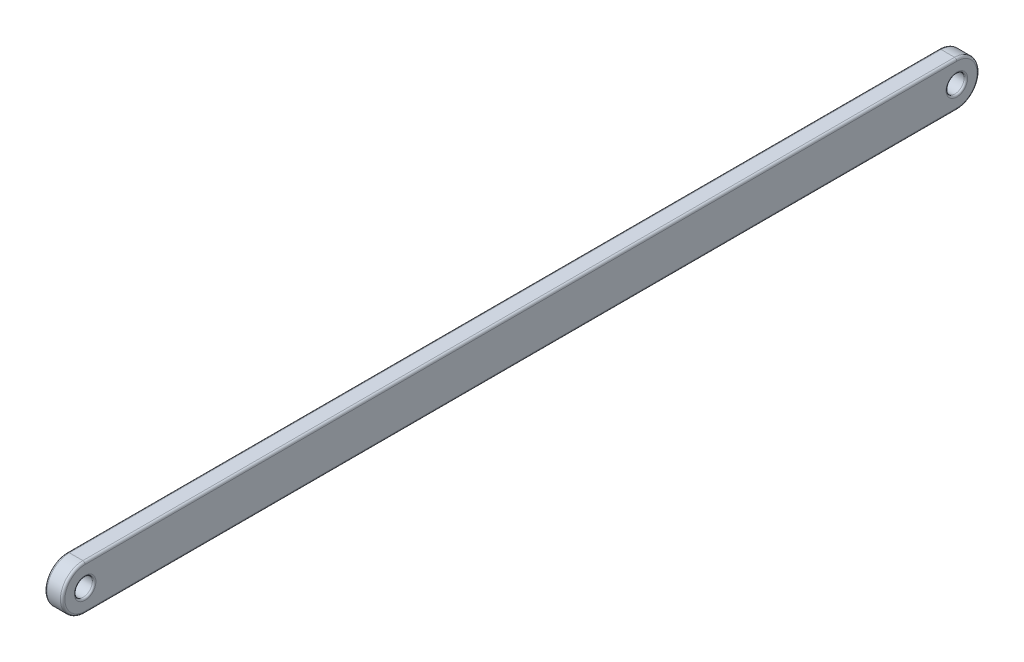
from build123d import *

# Parameters (mm, degrees)
SKETCH1_R           = 0.5
BOSS_EXTRUDE1_DEPTH = 1
FILLET1_R           = 0.125
FILLET2_R           = 0.1


with BuildPart() as part:
    # Sketch1 → Boss-Extrude1 (new body)
    with BuildSketch(Plane(origin=(0, 0, 0), x_dir=(0, 0, -1), z_dir=(1, 0, 0))):
        with BuildLine():
            Line((0, 0), (48.5, 0))
            ThreePointArc((48.5, 0), (49.75, -1.25), (48.5, -2.5))
            Line((48.5, -2.5), (0, -2.5))
            ThreePointArc((0, -2.5), (-1.25, -1.25), (0, 0))
        make_face()
        with Locations((0, -1.25)):
            Circle(SKETCH1_R, mode=Mode.SUBTRACT)
        with Locations((48.5, -1.25)):
            Circle(SKETCH1_R, mode=Mode.SUBTRACT)
    extrude(amount=BOSS_EXTRUDE1_DEPTH)

    # Fillet1
    fillet1_edges = [part.edges().sort_by_distance(p)[0] for p in [
        (1, -2.5, -24.25),
        (0, -2.5, -24.25),
        (0, 0, -24.25),
        (1, 0, -24.25),
        (0, -1.25, -49.75),
        (1, -1.25, -49.75),
        (0, -1.25, 1.25),
        (1, -1.25, 1.25),
    ]]
    fillet(fillet1_edges, radius=FILLET1_R)

    # Fillet2
    fillet2_edges = [part.edges().sort_by_distance(p)[0] for p in [
        (0, -1.25, 0.5),
        (1, -1.25, 0.5),
        (0, -1.25, -48),
        (1, -1.25, -48),
    ]]
    fillet(fillet2_edges, radius=FILLET2_R)


solid = part.part
